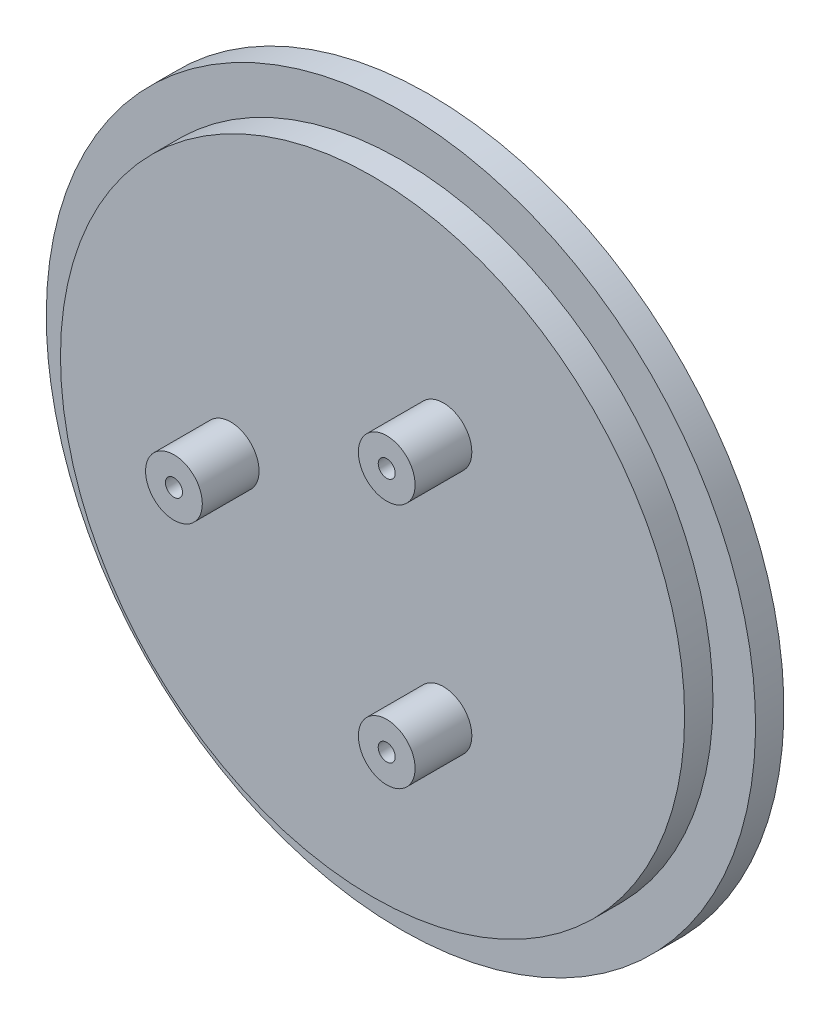
from build123d import *

# Parameters (mm, degrees)
SKETCH_1_R          = 22
EXTRUDE_1_DEPTH     = 2
SKETCH_2_R          = 2
SKETCH_2_R_2        = 0.6
EXTRUDE_2_DEPTH     = 4
SKETCH_3_R          = 25
EXTRUDE_3_DEPTH     = 2
CUT_EXTRUDE_2_DEPTH = 1
SKETCH_6_R          = 5.45
SKETCH_6_R_2        = 3.85
CUT_EXTRUDE_3_DEPTH = 1.3
CUT_EXTRUDE_START   = -18.5
SKETCH_8_R          = 0.6
CUT_EXTRUDE_4_DEPTH = 18.5
SKETCH_9_R          = 16.695755265
CUT_EXTRUDE_5_DEPTH = 2
SKETCH_10_R         = 1.6
CUT_EXTRUDE_6_DEPTH = 1
SKETCH_11_R         = 1.6
CUT_EXTRUDE_7_DEPTH = 3
SKETCH_13_R         = 2
SKETCH_13_R_2       = 0.6
EXTRUDE_4_DEPTH     = 2


with BuildPart() as part:
    # 草图1 → 凸台-拉伸1 (new body)
    with BuildSketch(Plane.XY):
        Circle(SKETCH_1_R)
    extrude(amount=EXTRUDE_1_DEPTH)

    # 草图2 → 凸台-拉伸2 (add)
    # profile 1 of 3: a face of its own
    with BuildSketch(Plane.XY.offset(2)):
        with Locations((-10, 0)):
            Circle(SKETCH_2_R)
        with Locations((-10, 0)):
            Circle(SKETCH_2_R_2, mode=Mode.SUBTRACT)
    # profile 2 of 3: a face of its own
    with BuildSketch(Plane.XY.offset(2)):
        with Locations((5, 8.660254038)):
            Circle(SKETCH_2_R)
        with Locations((5, 8.660254038)):
            Circle(SKETCH_2_R_2, mode=Mode.SUBTRACT)
    # profile 3 of 3: a face of its own
    with BuildSketch(Plane.XY.offset(2)):
        with Locations((5, -8.660254038)):
            Circle(SKETCH_2_R)
        with Locations((5, -8.660254038)):
            Circle(SKETCH_2_R_2, mode=Mode.SUBTRACT)
    extrude(amount=EXTRUDE_2_DEPTH)

    # 草图3 → 凸台-拉伸3 (add)
    with BuildSketch(Plane(origin=(0, 0, 0), x_dir=(-1, 0, 0), z_dir=(0, 0, -1))):
        Circle(SKETCH_3_R)
    extrude(amount=EXTRUDE_3_DEPTH)

    # 草图5 → 切除-拉伸2 (cut)
    with BuildSketch(Plane(origin=(0, 0, -2), x_dir=(-1, 0, 0), z_dir=(0, 0, -1))):
        Polygon((21, -3.95), (21, -4), (29.149006969, -4), (29.149006969, 4), (21, 4), align=None)
    extrude(amount=-CUT_EXTRUDE_2_DEPTH, mode=Mode.SUBTRACT)

    # 草图6 → 切除-拉伸3 (cut)
    # profile 1 of 3: a face of its own
    with BuildSketch(Plane(origin=(0, 0, -2), x_dir=(-1, 0, 0), z_dir=(0, 0, -1))):
        with Locations((-18, 0)):
            Circle(SKETCH_6_R)
        with Locations((-18, 0)):
            Circle(SKETCH_6_R_2, mode=Mode.SUBTRACT)
    # profile 2 of 3: a face of its own
    with BuildSketch(Plane(origin=(0, 0, -2), x_dir=(-1, 0, 0), z_dir=(0, 0, -1))):
        with Locations((9, 15.588457268)):
            Circle(SKETCH_6_R)
        with Locations((9, 15.588457268)):
            Circle(SKETCH_6_R_2, mode=Mode.SUBTRACT)
    # profile 3 of 3: a face of its own
    with BuildSketch(Plane(origin=(0, 0, -2), x_dir=(-1, 0, 0), z_dir=(0, 0, -1))):
        with Locations((9, -15.588457268)):
            Circle(SKETCH_6_R)
        with Locations((9, -15.588457268)):
            Circle(SKETCH_6_R_2, mode=Mode.SUBTRACT)
    extrude(amount=-CUT_EXTRUDE_3_DEPTH, mode=Mode.SUBTRACT)

    # 草图8 → 切除-拉伸4 (cut)
    with BuildSketch(Plane.XY.offset(6).offset(CUT_EXTRUDE_START)):
        with Locations((5, -8.660254038)):
            Circle(SKETCH_8_R)
        with Locations((-10, 0)):
            Circle(SKETCH_8_R)
        with Locations((5, 8.660254038)):
            Circle(SKETCH_8_R)
    extrude(amount=CUT_EXTRUDE_4_DEPTH, mode=Mode.SUBTRACT)

    # 草图9 → 切除-拉伸5 (cut)
    with BuildSketch(Plane.XY.offset(6)):
        Circle(SKETCH_9_R)
    extrude(amount=-CUT_EXTRUDE_5_DEPTH, mode=Mode.SUBTRACT)

    # 草图10 → 切除-拉伸6 (cut)
    with BuildSketch(Plane(origin=(0, 0, -2), x_dir=(-1, 0, 0), z_dir=(0, 0, -1))):
        with Locations((-5, -8.660254038)):
            Circle(SKETCH_10_R)
        with Locations((-5, 8.660254038)):
            Circle(SKETCH_10_R)
    extrude(amount=-CUT_EXTRUDE_6_DEPTH, mode=Mode.SUBTRACT)

    # 草图11 → 切除-拉伸7 (cut)
    with BuildSketch(Plane(origin=(0, 0, -2), x_dir=(-1, 0, 0), z_dir=(0, 0, -1))):
        with Locations((10, 0)):
            Circle(SKETCH_11_R)
    extrude(amount=-CUT_EXTRUDE_7_DEPTH, mode=Mode.SUBTRACT)

    # 草图13 → 凸台-拉伸4 (add)
    # profile 1 of 3: a face of its own
    with BuildSketch(Plane.XY.offset(4)):
        with Locations((-10, 0)):
            Circle(SKETCH_13_R)
        with Locations((-10, 0)):
            Circle(SKETCH_13_R_2, mode=Mode.SUBTRACT)
    # profile 2 of 3: a face of its own
    with BuildSketch(Plane.XY.offset(4)):
        with Locations((5, 8.660254038)):
            Circle(SKETCH_13_R)
        with Locations((5, 8.660254038)):
            Circle(SKETCH_13_R_2, mode=Mode.SUBTRACT)
    # profile 3 of 3: a face of its own
    with BuildSketch(Plane.XY.offset(4)):
        with Locations((5, -8.660254038)):
            Circle(SKETCH_13_R)
        with Locations((5, -8.660254038)):
            Circle(SKETCH_13_R_2, mode=Mode.SUBTRACT)
    extrude(amount=EXTRUDE_4_DEPTH)


solid = part.part
